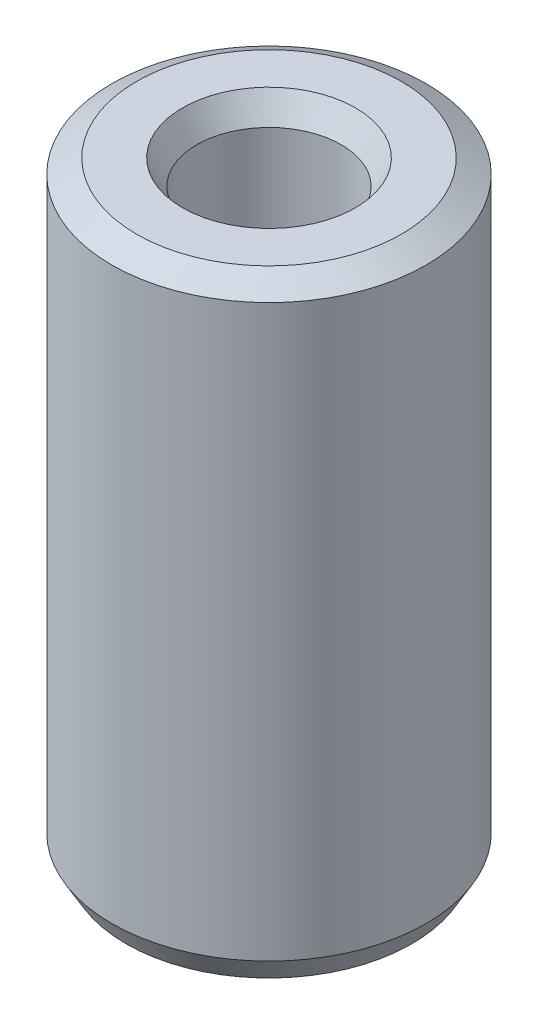
from build123d import *
from OCP.BRepFilletAPI import BRepFilletAPI_MakeChamfer

# Parameters (mm, degrees)
SKETCH1_R           = 35
BOSS_EXTRUDE1_DEPTH = 135.710383682
SKETCH2_R           = 16.09139687
CUT_EXTRUDE1_DEPTH  = 145.455211879
CHAMFER1_SIZE       = 3.182664232
CHAMFER1_SIZE2      = 5.512536154


with BuildPart() as part:
    # Sketch1 → Boss-Extrude1 (new body)
    with BuildSketch(Plane(origin=(0, 0, 0), x_dir=(1, 0, 0), z_dir=(0, 1, 0))):
        Circle(SKETCH1_R)
    extrude(amount=BOSS_EXTRUDE1_DEPTH)

    # Sketch2 → Cut-Extrude1 (cut, through all)
    with BuildSketch(Plane(origin=(0, 0, 0), x_dir=(1, 0, 0), z_dir=(0, 1, 0))):
        Circle(SKETCH2_R)
    extrude(amount=CUT_EXTRUDE1_DEPTH, mode=Mode.SUBTRACT)

    # Chamfer1: one chamfer whose edges measure the first distance from different faces: ONE call of the kernel's chamfer builder (chamfer() names one face for all edges)
    chamfer1_edges_1 = [part.edges().sort_by_distance(p)[0] for p in [
        (-16.09139687, 135.710383682, 0),
    ]]
    chamfer1_side_1 = [part.faces().sort_by_distance(p)[0] for p in [
        (-34.010050506, 135.710383682, 0),
    ]]
    chamfer1_edges_2 = [part.edges().sort_by_distance(p)[0] for p in [
        (-16.09139687, 0, 0),
    ]]
    chamfer1_side_2 = [part.faces().sort_by_distance(p)[0] for p in [
        (-16.09139687, 67.855191841, 0),
    ]]
    chamfer1_edges_3 = [part.edges().sort_by_distance(p)[0] for p in [
        (-35, 0, 0),
    ]]
    chamfer1_side_3 = [part.faces().sort_by_distance(p)[0] for p in [
        (-34.010050506, 0, 0),
    ]]
    chamfer1_edges_4 = [part.edges().sort_by_distance(p)[0] for p in [
        (-35, 135.710383682, 0),
    ]]
    chamfer1_side_4 = [part.faces().sort_by_distance(p)[0] for p in [
        (-35, 67.855191841, 0),
    ]]
    chamfer1 = BRepFilletAPI_MakeChamfer(part.part.solid().wrapped)
    for e in chamfer1_edges_1:
        chamfer1.Add(CHAMFER1_SIZE, CHAMFER1_SIZE2, e.wrapped, chamfer1_side_1[0].wrapped)  # the first distance lies on this face
    for e in chamfer1_edges_2:
        chamfer1.Add(CHAMFER1_SIZE, CHAMFER1_SIZE2, e.wrapped, chamfer1_side_2[0].wrapped)  # the first distance lies on this face
    for e in chamfer1_edges_3:
        chamfer1.Add(CHAMFER1_SIZE, CHAMFER1_SIZE2, e.wrapped, chamfer1_side_3[0].wrapped)  # the first distance lies on this face
    for e in chamfer1_edges_4:
        chamfer1.Add(CHAMFER1_SIZE, CHAMFER1_SIZE2, e.wrapped, chamfer1_side_4[0].wrapped)  # the first distance lies on this face
    add(Compound.cast(chamfer1.Shape()), mode=Mode.REPLACE)


solid = part.part
